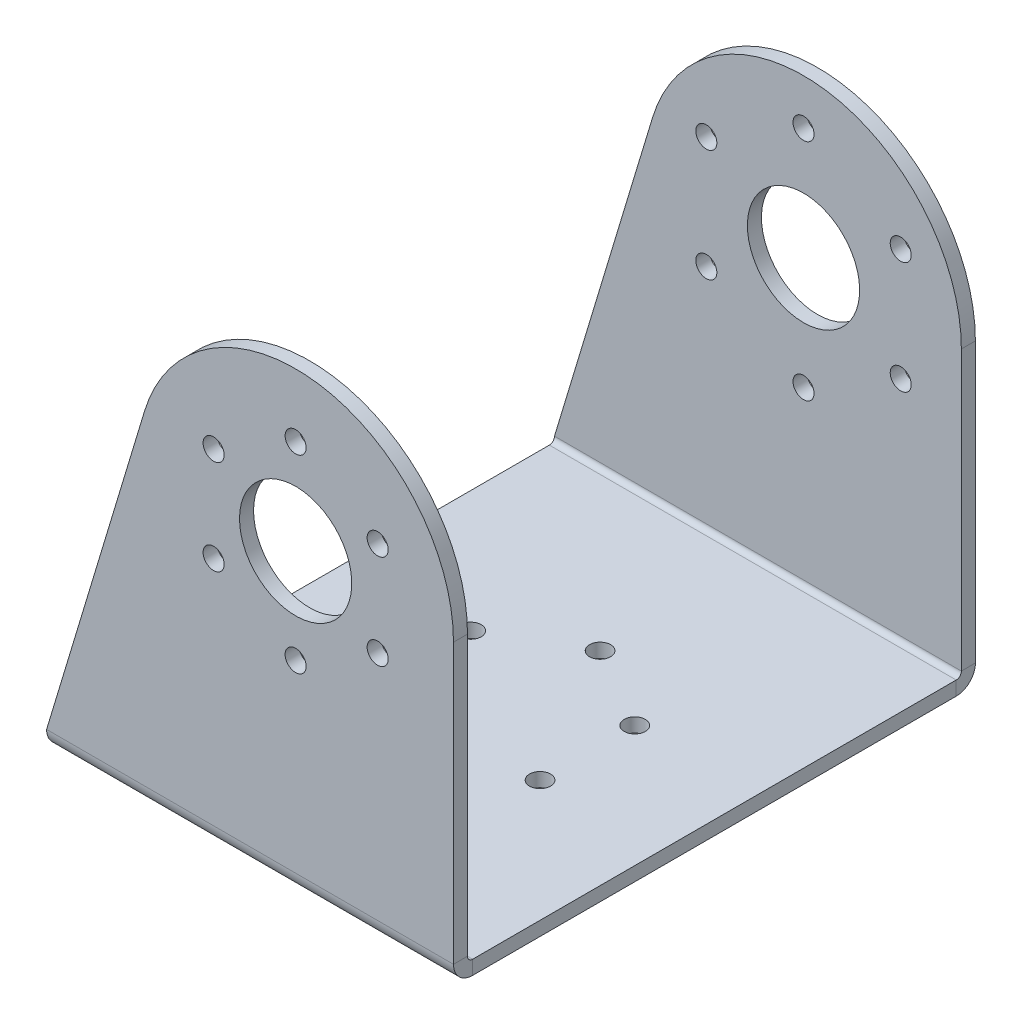
from build123d import *

# Parameters (mm, degrees)
SKETCH_1_R                         = 1.5
SM_BASE_FLANGE_1_DEPTH             = 2
SM_EDGE_FLANGE_1_STRIP_W           = 9.4732
SM_EDGE_FLANGE_1_STRIP_H           = 2
SM_EDGE_FLANGE_1_STRIP_CUT_DEPTH   = 58
SM_EDGE_FLANGE_1_STRIP_2_W         = 9.4732
SM_EDGE_FLANGE_1_STRIP_2_H         = 2
SM_EDGE_FLANGE_1_STRIP_CUT_2_DEPTH = 58
SM_EDGE_FLANGE_1_DEPTH             = 58
SM_EDGE_FLANGE_1_BEND_DEPTH        = 58
SKETCH_12_R                        = 1.5
SKETCH_12_R_2                      = 8
CUT_EXTRUDE_1_DEPTH                = 10
SKETCH_21_R                        = 1.5
SKETCH_21_R_2                      = 8
CUT_EXTRUDE_2_DEPTH                = 10
CUT_EXTRUDE_3_DEPTH                = 102.712142835


# Sheet-metal steps are written as plain solids
with BuildPart() as part:
    # Sketch 1 → 基体-法兰1 (new body)
    with BuildSketch(Plane(origin=(0, 0, 0), x_dir=(1, 0, 0), z_dir=(0, 1, 0))):
        Polygon((-29, -36), (-29, 36), (-29, 38), (29, 38), (29, 36), (29, -36), (29, -36.4), (-29, -36.4), align=None)
        with Locations(Location((0, 13.5, 0), (0, 0, 270))):
            Circle(SKETCH_1_R, mode=Mode.SUBTRACT)
        with Locations(Location((11.691342951, 6.75, 0), (0, 0, 270))):
            Circle(SKETCH_1_R, mode=Mode.SUBTRACT)
        with Locations(Location((11.691342951, -6.75, 0), (0, 0, 270))):
            Circle(SKETCH_1_R, mode=Mode.SUBTRACT)
        with Locations(Location((0, -13.5, 0), (0, 0, 270))):
            Circle(SKETCH_1_R, mode=Mode.SUBTRACT)
        with Locations(Location((-11.691342951, -6.75, 0), (0, 0, 270))):
            Circle(SKETCH_1_R, mode=Mode.SUBTRACT)
        with Locations(Location((-11.691342951, 6.75, 0), (0, 0, 270))):
            Circle(SKETCH_1_R, mode=Mode.SUBTRACT)
    extrude(amount=-SM_BASE_FLANGE_1_DEPTH)

    # 边线-法兰1 strip (across the edge) → 边线-法兰1 strip cut (cut)
    with BuildSketch(Plane(origin=(29, 0, -38), x_dir=(0, 0, 1), z_dir=(-1, 0, 0))):
        with Locations((-2, -1)):
            Rectangle(SM_EDGE_FLANGE_1_STRIP_W, SM_EDGE_FLANGE_1_STRIP_H)
    extrude(amount=SM_EDGE_FLANGE_1_STRIP_CUT_DEPTH, mode=Mode.SUBTRACT)

    # 边线-法兰1 strip 2 (across the edge) → 边线-法兰1 strip cut 2 (cut)
    with BuildSketch(Plane(origin=(-29, 0, 36.4), x_dir=(0, 0, -1), z_dir=(1, 0, 0))):
        with Locations((-2, -1)):
            Rectangle(SM_EDGE_FLANGE_1_STRIP_2_W, SM_EDGE_FLANGE_1_STRIP_2_H)
    extrude(amount=SM_EDGE_FLANGE_1_STRIP_CUT_2_DEPTH, mode=Mode.SUBTRACT)

    # 边线-法兰1 section (across the edge) → 边线-法兰1 (add)
    with BuildSketch(Plane(origin=(29, 0, -38), x_dir=(0, 0, 1), z_dir=(-1, 0, 0))):
        with BuildLine():
            Line((0, 0.7366), (0, 63))
            Line((0, 63), (2, 63))
            Line((2, 63), (2, 0.7366))
            ThreePointArc((2, 0.7366), (2.215745145, 0.215745145), (2.7366, 0))
            Line((2.7366, 0), (2.7366, -2))
            ThreePointArc((2.7366, -2), (0.801531583, -1.198468417), (0, 0.7366))
        make_face()
    extrude(amount=SM_EDGE_FLANGE_1_DEPTH)

    # 边线-法兰1 section 2 (across the edge) → 边线-法兰1 bend (add)
    with BuildSketch(Plane(origin=(-29, 0, 36.4), x_dir=(0, 0, -1), z_dir=(1, 0, 0))):
        with BuildLine():
            Line((0, 0.7366), (0, 63))
            Line((0, 63), (2, 63))
            Line((2, 63), (2, 0.7366))
            ThreePointArc((2, 0.7366), (2.215745145, 0.215745145), (2.7366, 0))
            Line((2.7366, 0), (2.7366, -2))
            ThreePointArc((2.7366, -2), (0.801531583, -1.198468417), (0, 0.7366))
        make_face()
    extrude(amount=SM_EDGE_FLANGE_1_BEND_DEPTH)

    # 草图12 → 切除-拉伸1 (cut)
    with BuildSketch(Plane(origin=(0, 0, -38), x_dir=(-1, 0, 0), z_dir=(0, 0, -1))):
        with BuildLine():
            ThreePointArc((-29, 40.5), (-22.409902591, 56.409902563), (-6.50000004, 63))
            Line((-6.50000004, 63), (-29, 63))
            Line((-29, 63), (-29, 40.5))
        make_face()
        with Locations(Location((-6.5, 56.5, 0), (0, 0, 270))):
            Circle(SKETCH_12_R)
        with Locations(Location((7.356406461, 48.5, 0), (0, 0, 270))):
            Circle(SKETCH_12_R)
        with Locations(Location((-20.356406461, 48.5, 0), (0, 0, 270))):
            Circle(SKETCH_12_R)
        with Locations(Location((-20.356406461, 32.5, 0), (0, 0, 270))):
            Circle(SKETCH_12_R)
        with Locations(Location((-6.5, 24.5, 0), (0, 0, 270))):
            Circle(SKETCH_12_R)
        with Locations(Location((7.356406461, 32.5, 0), (0, 0, 270))):
            Circle(SKETCH_12_R)
        with Locations(Location((-6.5, 40.5, 0), (0, 0, 270))):
            Circle(SKETCH_12_R_2)
    extrude(amount=-CUT_EXTRUDE_1_DEPTH, mode=Mode.SUBTRACT)

    # 草图21 → 切除-拉伸2 (cut)
    with BuildSketch(Plane(origin=(0, 0, 34.4), x_dir=(-1, 0, 0), z_dir=(0, 0, -1))):
        with Locations((5.191342951, 47.25)):
            Circle(SKETCH_21_R)
        with Locations(Location((-6.5, 40.5, 0), (0, 0, 270))):
            Circle(SKETCH_21_R_2)
        with Locations((-6.5, 54)):
            Circle(SKETCH_21_R)
        with BuildLine():
            ThreePointArc((-29, 40.5), (-22.409902577, 56.409902577), (-6.5, 63))
            Line((-6.5, 63), (-29, 63))
            Line((-29, 63), (-29, 40.5))
        make_face()
        with Locations((-18.191342951, 47.25)):
            Circle(SKETCH_21_R)
        with Locations((-18.191342951, 33.75)):
            Circle(SKETCH_21_R)
        with Locations((-6.5, 27)):
            Circle(SKETCH_21_R)
        with Locations((5.191342951, 33.75)):
            Circle(SKETCH_21_R)
    extrude(amount=-CUT_EXTRUDE_2_DEPTH, mode=Mode.SUBTRACT)

    # 草图22 → 切除-拉伸3 (cut, through all)
    with BuildSketch(Plane(origin=(0, 0, -38), x_dir=(-1, 0, 0), z_dir=(0, 0, -1))):
        with BuildLine():
            Line((15.040771003, 46.999629574), (29, 0.7366))
            Line((29, 0.7366), (29, 63))
            Line((29, 63), (-6.5, 63))
            ThreePointArc((-6.5, 63), (6.91656317, 58.56227651), (15.040771003, 46.999629574))
        make_face()
    extrude(amount=-CUT_EXTRUDE_3_DEPTH, mode=Mode.SUBTRACT)


solid = part.part
